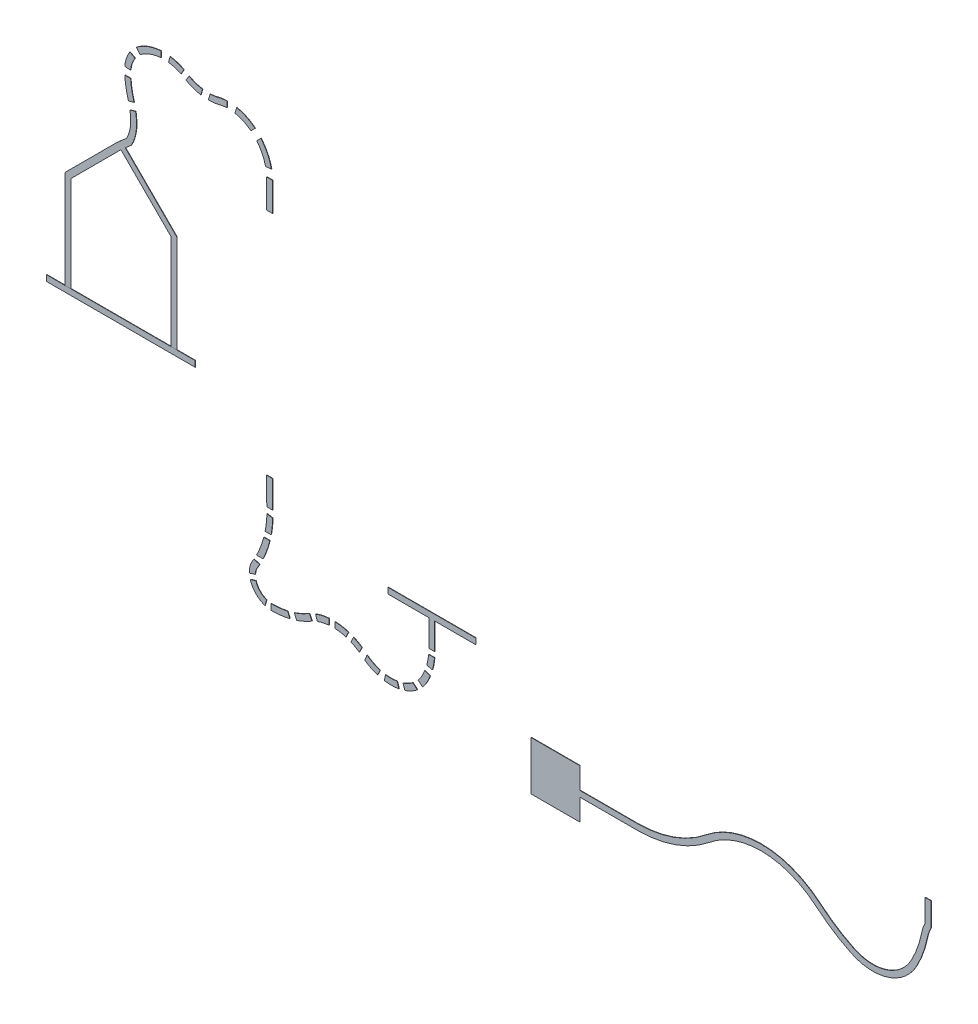
from build123d import *

# Parameters (mm, degrees)
EXTRUDE_THIN4_DEPTH = 2
SKETCH3_W           = 250
SKETCH3_H           = 250
BOSS_EXTRUDE3_DEPTH = 2
SKETCH4_W           = 450
SKETCH4_H           = 30
BOSS_EXTRUDE4_DEPTH = 2
SKETCH5_W           = 30
SKETCH5_H           = 500
BOSS_EXTRUDE5_DEPTH = 2
SKETCH6_W           = 760
SKETCH6_H           = 30
BOSS_EXTRUDE7_DEPTH = 2
CUT_EXTRUDE23_DEPTH = 2
BOSS_EXTRUDE8_DEPTH = 2
SKETCH9_W           = 67.984729371
SKETCH9_H           = 29.661652699
CUT_EXTRUDE28_DEPTH = 2


# Read off the part's stored shape, not the designer's step: Extrude-Thin4
with BuildPart() as part:
    # Extrude-Thin4 outline → Extrude-Thin4 (new body)
    with BuildSketch(Plane.XY):
        with BuildLine():
            Line((580.329534742, 1867.651110272), (600, 1845))
            Line((600, 1845), (865, 1580))
            Line((865, 1580), (886.213203436, 1601.213203436))
            Line((886.213203436, 1601.213203436), (622.7072175, 1864.719189371))
            Line((622.7072175, 1864.719189371), (653.403971795, 1891.376577537))
            ThreePointArc((653.403971795, 1891.376577537), (673.30803603, 1941.641063842), (680.084696225, 1995.276567319))
            ThreePointArc((680.084696225, 1995.276567319), (676.532858701, 2045.057080452), (665.949306803, 2093.829034142))
            ThreePointArc((665.949306803, 2093.829034142), (653.403971795, 2151.641430576), (649.193760322, 2210.649334548))
            ThreePointArc((649.193760322, 2210.649334548), (665.949306803, 2275.785664392), (712.05624475, 2324.751367457))
            ThreePointArc((712.05624475, 2324.751367457), (818.027452504, 2355.435014772), (923.998660258, 2324.751367457))
            ThreePointArc((923.998660258, 2324.751367457), (1011.215225634, 2291.908815799), (1104.307879422, 2296.281490747))
            ThreePointArc((1104.307879422, 2296.281490747), (1185.947658515, 2298.341290514), (1260.339044564, 2264.648294402))
            ThreePointArc((1260.339044564, 2264.648294402), (1322.673710037, 2189.153082854), (1345, 2093.829034142))
            Line((1345, 2093.829034142), (1345, 1950))
            Line((1345, 1950), (1375, 1950))
            Line((1375, 1950), (1375, 2093.829034142))
            ThreePointArc((1375, 2093.829034142), (1349.553484223, 2202.475160007), (1278.507195252, 2288.521256108))
            ThreePointArc((1278.507195252, 2288.521256108), (1191.90848294, 2327.743136922), (1096.871945536, 2325.345332324))
            ThreePointArc((1096.871945536, 2325.345332324), (1015.894102839, 2321.541704759), (940.027651252, 2350.110220896))
            ThreePointArc((940.027651252, 2350.110220896), (818.027452504, 2385.435014772), (696.027253756, 2350.110220896))
            ThreePointArc((696.027253756, 2350.110220896), (639.673179521, 2290.262029098), (619.193760322, 2210.649334548))
            ThreePointArc((619.193760322, 2210.649334548), (623.707873677, 2147.382116479), (637.158757241, 2085.396700186))
            ThreePointArc((637.158757241, 2085.396700186), (646.836760583, 2040.797766355), (650.084696225, 1995.276567319))
            ThreePointArc((650.084696225, 1995.276567319), (644.874732457, 1951.604472445), (629.537269054, 1910.383630513))
            Line((629.537269054, 1910.383630513), (580.329534742, 1867.651110272))
        make_face()
        Polygon((578.786796564, 1866.213203436), (313.786796564, 1601.213203436), (335, 1580), (600, 1845), align=None)
        with BuildLine():
            Line((1375, 666.719429072), (1375, 776))
            Line((1375, 776), (1345, 776))
            Line((1345, 776), (1345, 665.356203402))
            ThreePointArc((1345, 665.356203402), (1333.631645459, 505.331182525), (1271.583250751, 357.387803134))
            ThreePointArc((1271.583250751, 357.387803134), (1264.844375754, 344.367498538), (1260.339044564, 330.416055643))
            ThreePointArc((1260.339044564, 330.416055643), (1282.260904948, 232.566505826), (1372.547552838, 188.938262968))
            ThreePointArc((1372.547552838, 188.938262968), (1474.465890598, 202.281284498), (1569.514565573, 241.410981413))
            ThreePointArc((1569.514565573, 241.410981413), (1705.577822181, 271.230050509), (1834.187549466, 217.73309052))
            ThreePointArc((1834.187549466, 217.73309052), (1945.045622854, 167.201036401), (2066.069190222, 181.211642034))
            ThreePointArc((2066.069190222, 181.211642034), (2124.350152694, 217.73309052), (2166.78545843, 271.860085755))
            ThreePointArc((2166.78545843, 271.860085755), (2195.300446849, 345.621452904), (2205, 424.105607464))
            Line((2205, 424.105607464), (2205, 560))
            Line((2205, 560), (2175, 560))
            Line((2175, 560), (2175, 424.105607464))
            ThreePointArc((2175, 424.105607464), (2166.203072501, 352.92506886), (2140.341645499, 286.02782226))
            ThreePointArc((2140.341645499, 286.02782226), (2104.28074565, 240.031496313), (2054.754439327, 208.996105537))
            ThreePointArc((2054.754439327, 208.996105537), (1949.713097583, 196.835723503), (1853.494807006, 240.694575801))
            ThreePointArc((1853.494807006, 240.694575801), (1708.250974391, 301.110717457), (1554.589589012, 267.434914142))
            ThreePointArc((1554.589589012, 267.434914142), (1466.743131436, 231.270230511), (1372.547552838, 218.938262968))
            ThreePointArc((1372.547552838, 218.938262968), (1305.765674919, 251.2085494), (1289.550840964, 323.58444155))
            ThreePointArc((1289.550840964, 323.58444155), (1292.534504034, 332.8238078), (1296.997335203, 341.446526163))
            ThreePointArc((1296.997335203, 341.446526163), (1362.650642161, 497.691651998), (1375, 666.719429072))
        make_face()
        with BuildLine():
            Line((4743.146363372, 469.489544408), (4743.146363372, 590))
            Line((4743.146363372, 590), (4713.146363372, 590))
            Line((4713.146363372, 590), (4713.146363372, 476.80172071))
            ThreePointArc((4713.146363372, 476.80172071), (4702.43034856, 451.046406111), (4695.194149847, 424.105607464))
            ThreePointArc((4695.194149847, 424.105607464), (4674.129161248, 348.308067614), (4642.030037807, 276.484345444))
            ThreePointArc((4642.030037807, 276.484345444), (4514.167923591, 169.944187771), (4348.118021685, 181.211642034))
            ThreePointArc((4348.118021685, 181.211642034), (4259.523549071, 231.128865216), (4178.041529075, 291.967916533))
            ThreePointArc((4178.041529075, 291.967916533), (4105.944254392, 342.976093751), (4025.898417544, 380.292513234))
            ThreePointArc((4025.898417544, 380.292513234), (3799.09677669, 400.468186566), (3591.824622503, 306.211642034))
            ThreePointArc((3591.824622503, 306.211642034), (3427.213067923, 213.395077999), (3240.997856648, 181.211642034))
            Line((3240.997856648, 181.211642034), (2947.198336269, 181.211642034))
            Line((2947.198336269, 181.211642034), (2947.198336269, 151.211642034))
            Line((2947.198336269, 151.211642034), (3240.997856648, 151.211642034))
            ThreePointArc((3240.997856648, 151.211642034), (3437.282062755, 185.13529486), (3610.794463195, 282.970619163))
            ThreePointArc((3610.794463195, 282.970619163), (3804.143731696, 370.895762838), (4015.710652135, 352.075329888))
            ThreePointArc((4015.710652135, 352.075329888), (4090.88230147, 317.031198797), (4158.589396103, 269.129034712))
            ThreePointArc((4158.589396103, 269.129034712), (4243.152441443, 205.989516875), (4335.096877833, 154.184806985))
            ThreePointArc((4335.096877833, 154.184806985), (4523.418661717, 141.406075637), (4668.430619953, 262.236213553))
            ThreePointArc((4668.430619953, 262.236213553), (4702.354536796, 338.143020875), (4724.617042587, 418.249552242))
            ThreePointArc((4724.617042587, 418.249552242), (4731.949838519, 444.56814594), (4743.146363372, 469.489544408))
        make_face()
    extrude(amount=EXTRUDE_THIN4_DEPTH)

    # Sketch3 → Boss-Extrude3 (add)
    with BuildSketch(Plane.XY):
        with Locations((2822.198336269, 165.681992538)):
            Rectangle(SKETCH3_W, SKETCH3_H)
    extrude(amount=BOSS_EXTRUDE3_DEPTH)

    # Sketch4 → Boss-Extrude4 (add)
    with BuildSketch(Plane.XY):
        with Locations((2190, 575)):
            Rectangle(SKETCH4_W, SKETCH4_H)
    extrude(amount=BOSS_EXTRUDE4_DEPTH)

    # Sketch5 → Boss-Extrude5 (add)
    with BuildSketch(Plane.XY):
        with Locations((328.786796564, 1351.213203436)):
            Rectangle(SKETCH5_W, SKETCH5_H)
        with Locations((871.213203436, 1351.213203436)):
            Rectangle(SKETCH5_W, SKETCH5_H)
    extrude(amount=BOSS_EXTRUDE5_DEPTH)

    # Sketch11 → Cut-Extrude23 (cut)
    with BuildSketch(Plane.XY):
        Polygon((1382.921810822, 2097.221475732), (1330.585888161, 2097.221475732), (1330.585888161, 2140.041776091), (1382.921810822, 2144.799587242), align=None)
        Polygon((1325.82807701, 2263.065178711), (1287.765587802, 2225.002689502), (1258.199189935, 2254.569087369), (1296.261679143, 2292.631576578), align=None)
        Polygon((1195.208804419, 2338.586866673), (1181.561118289, 2292.631576578), (1142.567729344, 2292.631576578), (1142.567729344, 2338.586866673), align=None)
        Polygon((1059.169525993, 2328.979122925), (1044.579534711, 2279.850847595), (1005.116033316, 2279.850847595), (1022.5593081, 2338.586866673), align=None)
        Polygon((952.599014021, 2350.929278831), (929.743479663, 2315.609221625), (905.059502556, 2328.979122925), (926.201034728, 2368.011355431), align=None)
        Polygon((853.336595602, 2390.10686738), (842.41631477, 2348.495239178), (805.240067511, 2350.929278831), (805.240067511, 2392.98346205), align=None)
        Polygon((674.537135216, 2344.179181835), (703.243088175, 2309.218857134), (684.23911128, 2279.850847595), (635.177441851, 2306.424753212), align=None)
        Polygon((610.544702606, 2225.002689502), (654.857288533, 2221.339613039), (654.857288533, 2185.504068322), (607.279569991, 2185.504068322), align=None)
        Polygon((619.193760322, 2075.006114788), (674.537135216, 2090.050866292), (684.23911128, 2054.361337062), (631.068429262, 2039.907218574), align=None)
    extrude(amount=CUT_EXTRUDE23_DEPTH, mode=Mode.SUBTRACT)

    # Sketch12 → Boss-Extrude8 (add)
    with BuildSketch(Plane.XY):
        Polygon((587.549501053, 1873.921005865), (609.250982836, 1852.219524083), (591.055610377, 1836.055610377), (571.096616578, 1858.523023449), align=None)
    extrude(amount=BOSS_EXTRUDE8_DEPTH)

    # Sketch9 → Cut-Extrude28 (cut)
    with BuildSketch(Plane.XY):
        Polygon((1944.053097481, 152.959712829), (1905.715254024, 161.32433322), (1932.738815184, 215.941404334), (1955.693742291, 206.312668212), align=None)
        Polygon((2175, 424.105607464), (2212.990894726, 424.105607464), (2212.990894726, 396.671791208), (2164.900374584, 396.671791208), align=None)
        Polygon((2158.342576382, 345.666694087), (2198.418009834, 336.922963152), (2190.788973534, 301.956546777), (2143.298982449, 319.439754965), align=None)
        Polygon((2113.329499936, 261.863319919), (2150.820779416, 229.898186297), (2127.021623635, 201.984622371), (2089.530344156, 233.949755993), align=None)
        Polygon((2039.011625866, 215.941404334), (2057.848740762, 158.822062869), (2025.476335257, 158.822062869), (2009.814635272, 206.312668212), align=None)
        Polygon((1864.447561635, 249.730709205), (1844.673344559, 202.588934228), (1812.841027826, 215.941404334), (1836.420637104, 263.597935948), align=None)
        Polygon((1792.229650976, 285.46285459), (1774.550017182, 249.730709205), (1744.549774277, 249.730709205), (1770.390195358, 301.956546777), align=None)
        Polygon((1695.384939123, 311.140048), (1695.384939123, 263.597935948), (1664.931332266, 263.597935948), (1664.931332266, 319.439754965), align=None)
        Polygon((1590.965456031, 301.956546777), (1607.118923255, 249.730709205), (1580.763266206, 239.769670141), (1556.958156613, 287.368991974), align=None)
        Polygon((1475.790636198, 263.569331058), (1501.948399262, 202.588934228), (1469.41326209, 188.632868777), (1443.255499026, 249.613265606), align=None)
        Polygon((1368.277621085, 233.079132643), (1368.277621085, 179.636190521), (1333.124846029, 179.636190521), (1350.701233557, 244.128153677), align=None)
        Polygon((1309.956897198, 287.368991974), (1244.588777233, 267.150612865), (1244.588777233, 294.662769375), (1309.956897198, 314.881148485), align=None)
        Polygon((1277.272837216, 396.671791208), (1264.078167023, 375.682181731), (1333.124846029, 356.86446975), (1343.973777805, 396.671791208), align=None)
        with Locations((1344.615672196, 508.922332216)):
            Rectangle(SKETCH9_W, SKETCH9_H)
        Polygon((1338.549311917, 607.353066534), (1338.549311917, 636.617844005), (1407.146590983, 636.617844005), (1396.769571515, 598.542081501), align=None)
    extrude(amount=CUT_EXTRUDE28_DEPTH, mode=Mode.SUBTRACT)


with BuildPart() as body_2:
    # Sketch6 → Boss-Extrude7 (new body)
    with BuildSketch(Plane.XY):
        with Locations((600, 1086.203203436)):
            Rectangle(SKETCH6_W, SKETCH6_H)
    extrude(amount=BOSS_EXTRUDE7_DEPTH)


solid = Compound([part.part, body_2.part])
